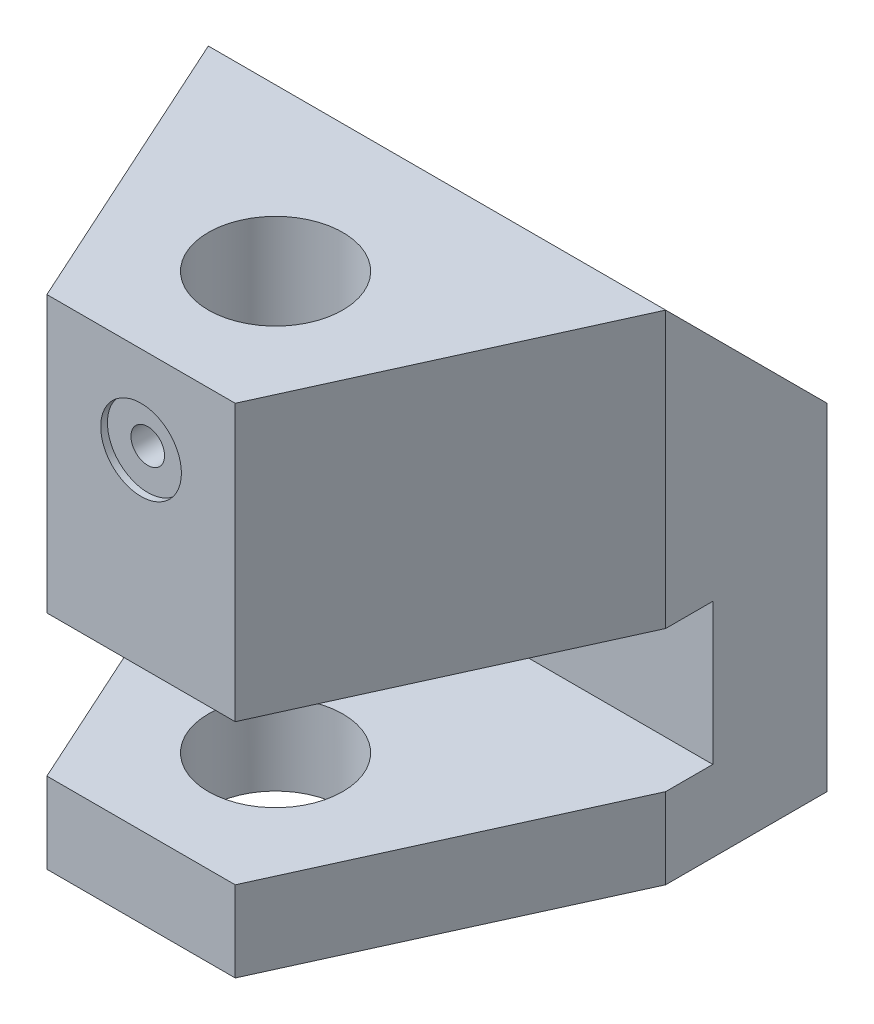
from build123d import *

# Parameters (mm, degrees)
ESQUISSE1_W             = 68
ESQUISSE1_H             = 74
BOSS_EXTRU_1_DEPTH      = 34
ESQUISSE2_W             = 51
ESQUISSE2_H             = 21
ENL_V_MAT_EXTRU_1_DEPTH = 107.094297679
CHANFREIN1_SIZE         = 44
CHANFREIN1_SIZE2        = 20
CHANFREIN2_SIZE         = 44
CHANFREIN2_SIZE2        = 20
CHANFREIN3_SIZE         = 24
PER_AGE1_D              = 20
PER_AGE1_DEPTH          = 74
PER_AGE1_TIP            = 6.00860619


# Read off the part's stored shape, not the designer's step: Perçage2
with BuildPart() as part:
    # Esquisse1 → Boss.-Extru.1 (new, symmetric)
    with BuildSketch(Plane.XY):
        with Locations((34, 37)):
            Rectangle(ESQUISSE1_W, ESQUISSE1_H)
    extrude(amount=BOSS_EXTRU_1_DEPTH, both=True)

    # Esquisse2 → Enlèv. mat.-Extru.1 (cut, through all)
    with BuildSketch(Plane(origin=(68, 0, 0), x_dir=(0, 0, -1), z_dir=(1, 0, 0))):
        with Locations((-8.5, 22.5)):
            Rectangle(ESQUISSE2_W, ESQUISSE2_H)
    extrude(amount=-ENL_V_MAT_EXTRU_1_DEPTH, mode=Mode.SUBTRACT)

    # Chanfrein1
    chanfrein1_edges = [part.edges().sort_by_distance(p)[0] for p in [
        (68, 6, 34),
        (68, 53.5, 34),
    ]]
    chanfrein1_side = [part.faces().sort_by_distance(p)[0] for p in [
        (68, 40.920600858, -2.298283262),
    ]]
    chamfer(chanfrein1_edges, length=CHANFREIN1_SIZE, length2=CHANFREIN1_SIZE2, reference=chanfrein1_side[0])

    # Chanfrein2
    chanfrein2_edges = [part.edges().sort_by_distance(p)[0] for p in [
        (0, 6, 34),
        (0, 53.5, 34),
    ]]
    chanfrein2_side = [part.faces().sort_by_distance(p)[0] for p in [
        (0, 40.920600858, -2.298283262),
    ]]
    chamfer(chanfrein2_edges, length=CHANFREIN2_SIZE, length2=CHANFREIN2_SIZE2, reference=chanfrein2_side[0])

    # Chanfrein3
    chanfrein3_edges = [part.edges().sort_by_distance(p)[0] for p in [
        (34, 74, -34),
    ]]
    chamfer(chanfrein3_edges, length=CHANFREIN3_SIZE)

    # Perçage1
    with Locations(Plane(origin=(0, 74, 0), x_dir=(1, 0, 0), z_dir=(0, 1, 0))):
        with Locations((34, -14)):
            Hole(PER_AGE1_D / 2, depth=PER_AGE1_DEPTH)
            with Locations((0, 0, -(PER_AGE1_DEPTH + PER_AGE1_TIP / 2))):  # 118° drill point
                Cone(0, PER_AGE1_D / 2, PER_AGE1_TIP, mode=Mode.SUBTRACT)

    # Perçage2 outline → Perçage2 (revolve, cut)
    with BuildSketch(Plane(origin=(34, 61, 0), x_dir=(1, 0, 0), z_dir=(0, -1, 0))):
        Polygon((0, 23.682322777), (2.5, 23.682322777), (2.5, 33), (6, 33), (6, 34), (0, 34), align=None)
    revolve(axis=Axis((34, 61, 0), (0, 0, 1)), mode=Mode.SUBTRACT)


solid = part.part
